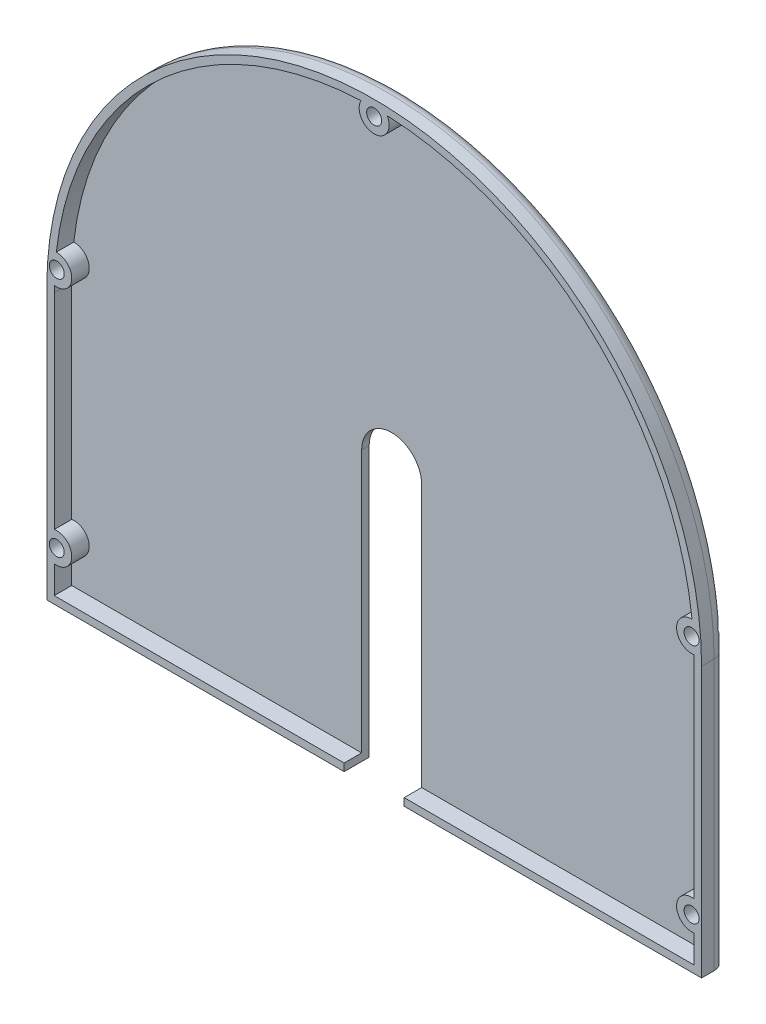
from build123d import *

# Parameters (mm, degrees)
SKETCH3_W                    = 131
SKETCH3_H                    = 54
BOSS_EXTRUDE2_DEPTH          = 5
F_3_0_3_DIAMETER_HOLE1_D     = 3
F_3_0_3_DIAMETER_HOLE1_DEPTH = 20
F_3_0_3_DIAMETER_HOLE1_TIP   = 0.901290929
SHELL1_T                     = -1.5
CUT_EXTRUDE1_DEPTH           = 114.452633288
FILLET2_START                = -28
FILLET2_DEPTH                = 120.497573337
FILLET2_2_ANGLE              = 180


with BuildPart() as part:
    # Sketch3 → Boss-Extrude2 (new body)
    with BuildSketch(Plane.XY):
        with BuildLine():
            Line((-65.5, 27), (65.5, 27))
            ThreePointArc((65.5, 27), (0, 92.5), (-65.5, 27))
        make_face()
        Rectangle(SKETCH3_W, SKETCH3_H)
    extrude(amount=BOSS_EXTRUDE2_DEPTH)

    # Ø3.0 (3) Diameter Hole1
    with Locations(Plane.XY.offset(5)):
        with Locations((-63.5, -17), (63.5, -17), (0, 89.5), (63.5, 31.210132452), (-63.5, 31.210132452)):
            Hole(F_3_0_3_DIAMETER_HOLE1_D / 2, depth=F_3_0_3_DIAMETER_HOLE1_DEPTH)
            with Locations((0, 0, -(F_3_0_3_DIAMETER_HOLE1_DEPTH + F_3_0_3_DIAMETER_HOLE1_TIP / 2))):  # 118° drill point
                Cone(0, F_3_0_3_DIAMETER_HOLE1_D / 2, F_3_0_3_DIAMETER_HOLE1_TIP, mode=Mode.SUBTRACT)

    # Shell1
    shell1_openings = [part.faces().sort_by_distance(p)[0] for p in [
        (0, 26.743328941, 5),
    ]]
    offset(amount=SHELL1_T, openings=shell1_openings)

    # Sketch6 → Cut-Extrude1 (cut, through all)
    with BuildSketch(Plane(origin=(0, 0, 0), x_dir=(-1, 0, 0), z_dir=(0, 0, -1))):
        with BuildLine():
            Line((-6, 27), (-6, -27))
            Line((-6, -27), (6, -27))
            Line((6, -27), (6, 27))
            ThreePointArc((6, 27), (0, 33), (-6, 27))
        make_face()
    extrude(amount=-CUT_EXTRUDE1_DEPTH, mode=Mode.SUBTRACT)

    # Fillet2: read off the stored shape, not the designer's step
    # Fillet2 outline → Fillet2 (cut)
    with BuildSketch(Plane(origin=(0, 0, 0), x_dir=(1, 0, 0), z_dir=(0, 1, 0)).offset(FILLET2_START)):
        with BuildLine():
            ThreePointArc((-65.5, -2.5), (-64.767766953, -0.732233047), (-63, 0))
            Line((-63, 0), (-65.5, 0))
            Line((-65.5, 0), (-65.5, -2.5))
        make_face()
        with BuildLine():
            ThreePointArc((63, 0), (64.767766953, -0.732233047), (65.5, -2.5))
            Line((65.5, -2.5), (65.5, 0))
            Line((65.5, 0), (63, 0))
        make_face()
    extrude(amount=FILLET2_DEPTH, mode=Mode.SUBTRACT)

    # Fillet2 2 outline → Fillet2 2 (revolve, cut)
    with BuildSketch(Plane.XZ.offset(-27)):
        with BuildLine():
            ThreePointArc((65.5, 2.5), (64.767766953, 0.732233047), (63, 0))
            Line((63, 0), (65.5, 0))
            Line((65.5, 0), (65.5, 2.5))
        make_face()
    revolve(axis=Axis((0, 27, 0), (0, 0, 1)), revolution_arc=FILLET2_2_ANGLE, mode=Mode.SUBTRACT)


solid = part.part
